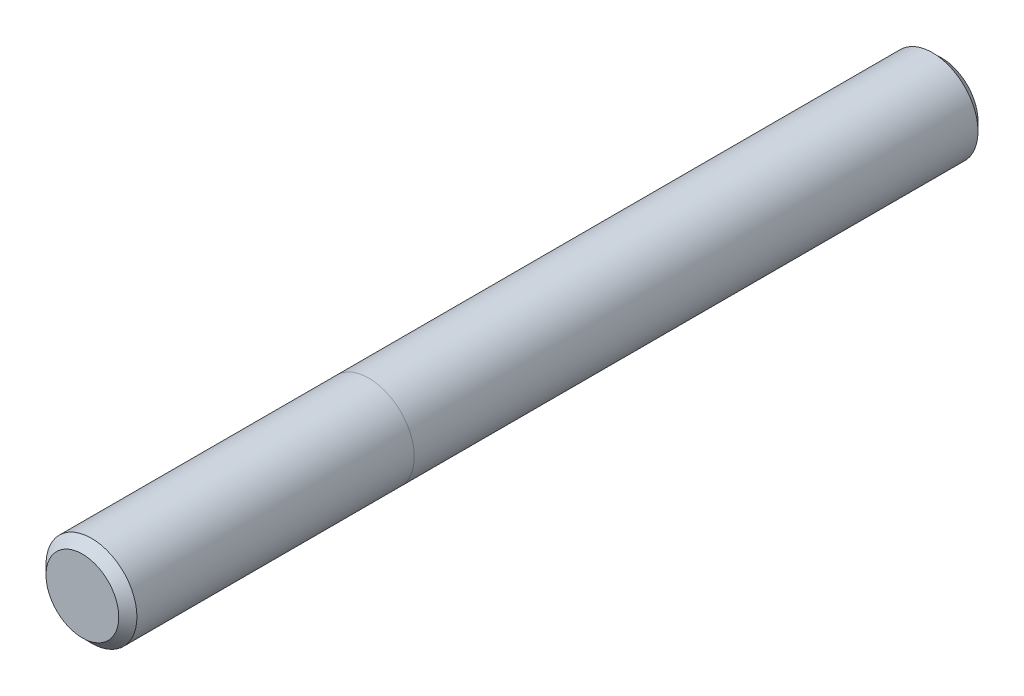
from build123d import *

# Parameters (mm, degrees)
SKETCH3_R           = 7.9375
BOSS_EXTRUDE1_DEPTH = 75
CHAMFER1_SIZE       = 1.5875


with BuildPart() as part:
    # Sketch3 → Boss-Extrude1 (new, symmetric)
    with BuildSketch(Plane.XY):
        Circle(SKETCH3_R)
    extrude(amount=BOSS_EXTRUDE1_DEPTH, both=True)

    # Chamfer1
    chamfer1_edges = [part.edges().sort_by_distance(p)[0] for p in [
        (-7.9375, 0, -75),
        (-7.9375, 0, 75),
    ]]
    chamfer(chamfer1_edges, length=CHAMFER1_SIZE)


solid = part.part
